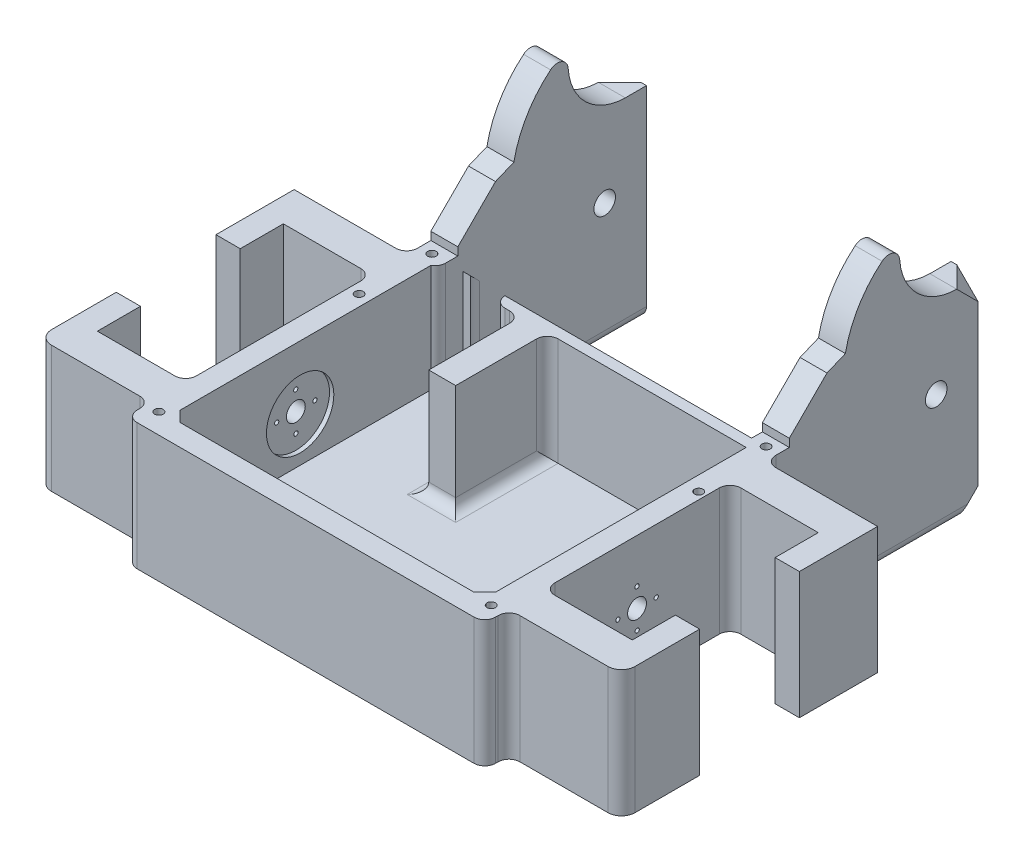
from build123d import *

# Parameters (mm, degrees)
BOSS_EXTRUDE1_DEPTH      = 50.8
BOSS_EXTRUDE1_DEPTH_BACK = 8.89
SKETCH3_W                = 168.91
SKETCH3_H                = 143.51
SKETCH3_W_2              = 148.59
SKETCH3_H_2              = 123.19
SKETCH3_3_W              = 148.59
SKETCH3_3_H              = 123.19
BOSS_EXTRUDE2_DEPTH      = 8.89
BOSS_EXTRUDE3_DEPTH      = 59.69
CUT_EXTRUDE1_DEPTH       = 239.691156361
CUT_EXTRUDE1_DEPTH_BACK  = 239.691156361
SKETCH5_R                = 4.445
SKETCH5_R_2              = 1.000000032
SKETCH5_R_3              = 1
FILLET1_R                = 5.08
SKETCH7_W                = 88.9
SKETCH7_H                = 95.25
BOSS_EXTRUDE4_DEPTH      = 12.7
CHAMFER1_SIZE            = 21.336
CHAMFER2_START           = -153
CHAMFER2_OUTLINE_W       = 18
CHAMFER2_OUTLINE_H       = 17
CHAMFER2_DEPTH           = 6.894626535
CHAMFER3_START           = -186
CHAMFER3_OUTLINE_W       = 15
CHAMFER3_OUTLINE_H       = 17
CHAMFER3_DEPTH           = 6.430939091
CHAMFER4_SIZE            = 5.08
CHAMFER5_SIZE            = 5.08
FILLET3_R                = 10.16
CHAMFER6_SIZE            = 5.08
CUT_EXTRUDE2_DEPTH       = 275.484237722
CUT_EXTRUDE2_DEPTH_BACK  = 275.484237722
SKETCH8_R                = 5.08
SKETCH9_R                = 2
SKETCH9_R_2              = 2.000000064
CUT_EXTRUDE3_DEPTH       = 12.7
SKETCH10_W               = 12.7
SKETCH10_H               = 43.18
BOSS_EXTRUDE5_DEPTH      = 50.8
SKETCH11_W               = 27.305
SKETCH11_H               = 50.8
CUT_EXTRUDE4_DEPTH       = 12.7
FILLET4_R                = 5.08
SKETCH12_R               = 15.875
CUT_EXTRUDE5_DEPTH       = 2.032
CUT_EXTRUDE6_START       = -2.032
SKETCH13_R               = 15.875
CUT_EXTRUDE6_DEPTH       = 2.032
FILLET5_R                = 5.08
FILLET6_R                = 5.08
SKETCH15_R               = 7.62
CUT_EXTRUDE7_DEPTH       = 5.08
BOSS_EXTRUDE6_DEPTH      = 12.7
FILLET9_R                = 6.35
BOSS_EXTRUDE7_START      = -12.7
BOSS_EXTRUDE7_DEPTH      = 12.7


with BuildPart() as part:
    # Sketch3 → Boss-Extrude1 (new, two sides: drawn at the far end of the back side and taken through both)
    with BuildSketch(Plane(origin=(0, 0, 0), x_dir=(1, 0, 0), z_dir=(0, 1, 0)).offset(-BOSS_EXTRUDE1_DEPTH_BACK)):
        Rectangle(SKETCH3_W, SKETCH3_H)
        Rectangle(SKETCH3_W_2, SKETCH3_H_2, mode=Mode.SUBTRACT)
    extrude(amount=BOSS_EXTRUDE1_DEPTH + BOSS_EXTRUDE1_DEPTH_BACK)

    # Sketch3<3> → Boss-Extrude2 (add)
    with BuildSketch(Plane(origin=(0, 0, 0), x_dir=(1, 0, 0), z_dir=(0, 1, 0))):
        Rectangle(SKETCH3_3_W, SKETCH3_3_H)
    extrude(amount=-BOSS_EXTRUDE2_DEPTH)

    # Sketch4 → Boss-Extrude3 (add)
    with BuildSketch(Plane(origin=(0, -8.89, 0), x_dir=(-1, 0, 0), z_dir=(0, -1, 0))):
        Polygon((137.454999918, 60.325), (84.455, 60.325), (84.455, 43.815), (126.024999918, 43.815), (126.024999918, 23.495), (137.454999918, 23.495), align=None)
        Polygon((126.025, -43.815), (84.455, -43.815), (84.455, -60.325), (137.455, -60.325), (137.455, -23.495), (126.025, -23.495), align=None)
        Polygon((-84.455, 43.815), (-84.455, 60.325), (-137.454999918, 60.325), (-137.454999918, 23.495), (-126.024999918, 23.495), (-126.024999918, 43.815), align=None)
        Polygon((-84.455, -43.815), (-126.025, -43.815), (-126.025, -23.495), (-137.455, -23.495), (-137.455, -60.325), (-84.455, -60.325), align=None)
    extrude(amount=-BOSS_EXTRUDE3_DEPTH)

    # Sketch5 → Cut-Extrude1 (cut, two sides: drawn at the far end of the back side and taken through both)
    with BuildSketch(Plane.ZY.offset(84.455).offset(-CUT_EXTRUDE1_DEPTH_BACK)):
        with Locations(Location((0, 20.955, 0), (0, 0, 180))):
            Circle(SKETCH5_R)
        with Locations(Location((-9.017, 20.955, 0), (0, 0, 180))):
            Circle(SKETCH5_R_2)
        with Locations(Location((9.017, 20.955, 0), (0, 0, 180))):
            Circle(SKETCH5_R_3)
        with Locations(Location((0.017538483, 29.972, 0), (0, 0, 180))):
            Circle(SKETCH5_R_3)
        with Locations(Location((-0.055629344, 11.938, 0), (0, 0, 180))):
            Circle(SKETCH5_R_3)
    extrude(amount=CUT_EXTRUDE1_DEPTH + CUT_EXTRUDE1_DEPTH_BACK, mode=Mode.SUBTRACT)

    # Fillet1
    fillet1_edges = [part.edges().sort_by_distance(p)[0] for p in [
        (84.455, 20.955, -60.325),
        (84.455, 20.955, -43.815),
        (-84.455, 20.955, -43.815),
        (-84.455, 20.955, -60.325),
        (-84.455, 20.955, 43.815),
        (-84.455, 20.955, 60.325),
        (84.455, 20.955, 71.755),
        (-84.455, 20.955, 71.755),
        (84.455, 20.955, 60.325),
        (84.455, 20.955, 43.815),
    ]]
    fillet(fillet1_edges, radius=FILLET1_R)

    # Sketch7 → Boss-Extrude4 (add)
    with BuildSketch(Plane.ZY.offset(84.455)):
        with Locations((-116.205, 28.287736962)):
            Rectangle(SKETCH7_W, SKETCH7_H)
    extrude(amount=-BOSS_EXTRUDE4_DEPTH)

    # Chamfer1
    # the kernel refuses this chamfer: 21.336 mm, written as the material it takes off along each edge
    with BuildSketch(Plane(origin=(-139.324428231, 75.912736962, -71.755), x_dir=(0, -1, 0), z_dir=(1, 0, 0))) as chamfer1_piece_1:
        Polygon((CHAMFER1_SIZE, 0), (0, CHAMFER1_SIZE), (0, 0), align=None)
    extrude(amount=122.438856462, mode=Mode.SUBTRACT)
    with BuildSketch(Plane(origin=(-139.324428231, -19.337263038, -71.755), x_dir=(0, 1, 0), z_dir=(1, 0, 0))) as chamfer1_piece_2_section:
        Polygon((CHAMFER1_SIZE, 0), (0, -CHAMFER1_SIZE), (0, 0), align=None)
    chamfer1_piece_2 = extrude(amount=122.438856462, mode=Mode.PRIVATE)
    chamfer1_piece_2 = split(chamfer1_piece_2, bisect_by=Plane(origin=(-139.324428231, -8.89, -71.755), z_dir=(0, -1, 0)), keep=Keep.TOP, mode=Mode.PRIVATE)
    add(chamfer1_piece_2, mode=Mode.SUBTRACT)

    # Chamfer2: read off the stored shape, not the designer's step
    # Chamfer2 outline → Chamfer2 (cut)
    with BuildSketch(Plane(origin=(0, 0, 0), x_dir=(0.8737038499063027, -0.34397789366389886, -0.34397789366389886), z_dir=(0.4864582023760161, 0.6178019170175401, 0.6178019170175401)).offset(CHAMFER2_START)):
        with Locations((-8, 99.5)):
            Rectangle(CHAMFER2_OUTLINE_W, CHAMFER2_OUTLINE_H)
    extrude(amount=CHAMFER2_DEPTH, mode=Mode.SUBTRACT)

    # Chamfer3: read off the stored shape, not the designer's step
    # Chamfer3 outline → Chamfer3 (cut)
    with BuildSketch(Plane(origin=(0, 0, 0), x_dir=(0.8164965809277258, 0.40824829046386313, -0.40824829046386313), z_dir=(0.5773502691896258, -0.5773502691896258, 0.5773502691896258)).offset(CHAMFER3_START)):
        with Locations((29.5, -59.5)):
            Rectangle(CHAMFER3_OUTLINE_W, CHAMFER3_OUTLINE_H)
    extrude(amount=CHAMFER3_DEPTH, mode=Mode.SUBTRACT)

    # Chamfer4
    chamfer4_edges = [part.edges().sort_by_distance(p)[0] for p in [
        (-74.295, 25.4, 61.595),
        (74.295, 25.4, 61.595),
    ]]
    chamfer(chamfer4_edges, length=CHAMFER4_SIZE)

    # Chamfer5
    chamfer5_edges = [part.edges().sort_by_distance(p)[0] for p in [
        (6.35, 50.8, -71.755),
    ]]
    chamfer(chamfer5_edges, length=CHAMFER5_SIZE)

    # Fillet3
    fillet3_edges = [part.edges().sort_by_distance(p)[0] for p in [
        (-71.755, 18.415, -71.755),
    ]]
    fillet(fillet3_edges, radius=FILLET3_R)

    # Chamfer6
    chamfer6_edges = [part.edges().sort_by_distance(p)[0] for p in [
        (-78.105, 75.912736962, -93.091),
    ]]
    chamfer(chamfer6_edges, length=CHAMFER6_SIZE)

    # Mirror1: part across plane


with BuildPart() as part_1:
    add(part.part)
    add(part.part.mirror(Plane.ZY))

    # Sketch8 → Cut-Extrude2 (cut, two sides: drawn at the far end of the back side and taken through both)
    with BuildSketch(Plane(origin=(-71.755, 0, 0), x_dir=(0, 0, -1), z_dir=(1, 0, 0)).offset(-CUT_EXTRUDE2_DEPTH_BACK)):
        with Locations((140.97, 37.812736962)):
            Circle(SKETCH8_R)
    extrude(amount=CUT_EXTRUDE2_DEPTH + CUT_EXTRUDE2_DEPTH_BACK, mode=Mode.SUBTRACT)

    # Sketch9 → Cut-Extrude3 (cut)
    with BuildSketch(Plane(origin=(0, 50.8, 0), x_dir=(1, 0, 0), z_dir=(0, 1, 0))):
        with Locations(Location((-78.769563039, 66.590491676, 0), (0, 0, 270))):
            Circle(SKETCH9_R)
        with Locations(Location((-79.531563039, 33.026568856, 0), (0, 0, 270))):
            Circle(SKETCH9_R)
        with Locations(Location((-78.642563039, -62.223431144, 0), (0, 0, 270))):
            Circle(SKETCH9_R_2)
        with Locations(Location((78.595485178, -62.865, 0), (0, 0, 270))):
            Circle(SKETCH9_R)
        with Locations(Location((78.595485178, 66.675, 0), (0, 0, 270))):
            Circle(SKETCH9_R)
        with Locations(Location((81.135485178, 32.385, 0), (0, 0, 270))):
            Circle(SKETCH9_R)
    extrude(amount=-CUT_EXTRUDE3_DEPTH, mode=Mode.SUBTRACT)

    # Sketch10 → Boss-Extrude5 (add)
    with BuildSketch(Plane(origin=(0, 0, 0), x_dir=(1, 0, 0), z_dir=(0, 1, 0))):
        with Locations((-25.7556, 40.005)):
            Rectangle(SKETCH10_W, SKETCH10_H)
    extrude(amount=BOSS_EXTRUDE5_DEPTH)

    # Sketch11 → Cut-Extrude4 (cut)
    with BuildSketch(Plane.XY.offset(-61.595)):
        with Locations((-58.1025, 25.4)):
            Rectangle(SKETCH11_W, SKETCH11_H)
    extrude(amount=-CUT_EXTRUDE4_DEPTH, mode=Mode.SUBTRACT)

    # Fillet4
    # the kernel refuses this fillet: 5.08 mm, written as the material it takes off along each edge
    with BuildSketch(Plane(origin=(-44.45, 58.42, -71.755), x_dir=(1, 0, 0), z_dir=(0, -1, 0))) as fillet4_piece_1:
        with BuildLine():
            CenterArc((FILLET4_R, FILLET4_R), FILLET4_R, 180, 90)
            Line((0, FILLET4_R), (-FILLET4_R * 0.02, FILLET4_R))
            Line((-FILLET4_R * 0.02, FILLET4_R), (-FILLET4_R * 0.02, -FILLET4_R * 0.02))
            Line((-FILLET4_R * 0.02, -FILLET4_R * 0.02), (FILLET4_R, -FILLET4_R * 0.02))
            Line((FILLET4_R, -FILLET4_R * 0.02), (FILLET4_R, 0))
        make_face()
    extrude(amount=58.42, mode=Mode.SUBTRACT)
    with BuildSketch(Plane(origin=(-44.45, 0, -61.595), x_dir=(0, 0, -1), z_dir=(0, 1, 0))) as fillet4_piece_2:
        with BuildLine():
            CenterArc((FILLET4_R, -FILLET4_R), FILLET4_R, 90, 90)
            Line((0, -FILLET4_R), (-FILLET4_R * 0.02, -FILLET4_R))
            Line((-FILLET4_R * 0.02, -FILLET4_R), (-FILLET4_R * 0.02, FILLET4_R * 0.02))
            Line((-FILLET4_R * 0.02, FILLET4_R * 0.02), (FILLET4_R, FILLET4_R * 0.02))
            Line((FILLET4_R, FILLET4_R * 0.02), (FILLET4_R, 0))
        make_face()
    extrude(amount=63.5, mode=Mode.SUBTRACT)
    with BuildSketch(Plane(origin=(-71.755, 61.798522628, -61.595), x_dir=(0, 0, -1), z_dir=(0, -1, 0))) as fillet4_piece_3:
        with BuildLine():
            CenterArc((4.399409051, -5.08), FILLET4_R, 90, 60)
            Line((0, -2.54), (-0.087988181, -2.4892))
            ThreePointArc((-0.087988181, -2.4892), (-0.1016, -1.27), (-0.1016, 0))
            Line((-0.1016, 0), (0, 0.1016))
            Line((0, 0.1016), (4.399409051, 0.1016))
            Line((4.399409051, 0.1016), (4.399409051, 0))
        make_face()
    extrude(amount=61.798522628, mode=Mode.SUBTRACT)

    # Sketch12 → Cut-Extrude5 (cut)
    with BuildSketch(Plane(origin=(-74.295, 0, 0), x_dir=(0, 0, -1), z_dir=(1, 0, 0))):
        with Locations((0, 20.955)):
            Circle(SKETCH12_R)
    extrude(amount=-CUT_EXTRUDE5_DEPTH, mode=Mode.SUBTRACT)

    # Sketch13 → Cut-Extrude6 (cut)
    with BuildSketch(Plane.ZY.offset(-74.295).offset(CUT_EXTRUDE6_START)):
        with Locations(Location((0, 20.955, 0), (0, 0, 180))):
            Circle(SKETCH13_R)
    extrude(amount=CUT_EXTRUDE6_DEPTH, mode=Mode.SUBTRACT)

    # Fillet5
    fillet5_edges = [part_1.edges().sort_by_distance(p)[0] for p in [
        (-19.4056, 0, -40.005),
        (-19.4056, 25.4, -61.595),
        (-32.1056, 25.4, -61.595),
        (-32.1056, 0, -40.005),
        (-25.7556, 0, -18.415),
    ]]
    fillet(fillet5_edges, radius=FILLET5_R)

    # Fillet6
    fillet6_edges = [part_1.edges().sort_by_distance(p)[0] for p in [
        (-71.755, -19.337263038, -126.873),
        (-84.455, -19.337263038, -121.873),
        (84.455, -19.337263038, -121.873),
        (71.755, -19.337263038, -126.873),
    ]]
    fillet(fillet6_edges, radius=FILLET6_R)

    # Sketch15 → Cut-Extrude7 (cut)
    with BuildSketch(Plane.ZY.offset(32.1056)):
        with Locations((-41.275, 27.94)):
            Circle(SKETCH15_R)
    extrude(amount=-CUT_EXTRUDE7_DEPTH, mode=Mode.SUBTRACT)

    # Sketch17 → Boss-Extrude6 (add)
    with BuildSketch(Plane.ZY.offset(84.455)):
        with BuildLine():
            Line((-150.655, 75.912736962), (-98.171, 75.912736962))
            ThreePointArc((-98.171, 75.912736962), (-104.299654898, 91.920369087), (-115.471784879, 104.91991557))
            ThreePointArc((-115.471784879, 104.91991557), (-120.708410024, 105.664070641), (-123.768126586, 101.349659413))
            ThreePointArc((-123.768126586, 101.349659413), (-132.250831328, 83.387695455), (-150.655, 75.912736962))
        make_face()
    extrude(amount=-BOSS_EXTRUDE6_DEPTH)

    # Fillet9
    fillet9_edges = [part_1.edges().sort_by_distance(p)[0] for p in [
        (-137.455, 20.955, 60.325),
        (137.455, 20.955, 60.325),
    ]]
    fillet(fillet9_edges, radius=FILLET9_R)

    # Sketch18 → Boss-Extrude7 (add)
    with BuildSketch(Plane(origin=(84.455, 0, 0), x_dir=(0, 0, -1), z_dir=(1, 0, 0)).offset(BOSS_EXTRUDE7_START)):
        with BuildLine():
            ThreePointArc((123.768126586, 101.349659413), (132.250831328, 83.387695455), (150.655, 75.912736962))
            Line((150.655, 75.912736962), (98.171, 75.912736962))
            ThreePointArc((98.171, 75.912736962), (104.299654898, 91.920369087), (115.471784879, 104.91991557))
            ThreePointArc((115.471784879, 104.91991557), (120.708410024, 105.664070641), (123.768126586, 101.349659413))
        make_face()
    extrude(amount=BOSS_EXTRUDE7_DEPTH)


solid = part_1.part
